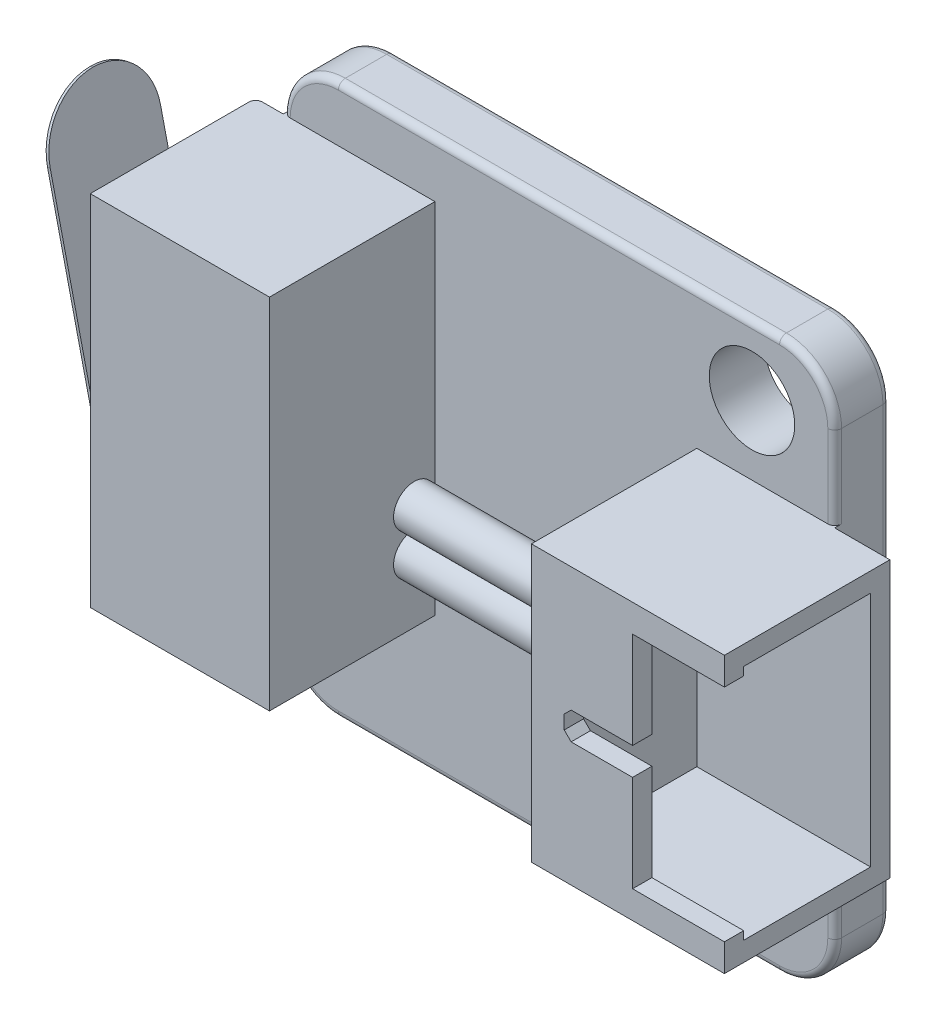
from build123d import *

# Parameters (mm, degrees)
CROQUIS1_W                          = 20
CROQUIS1_H                          = 20
SALIENTE_EXTRUIR1_DEPTH             = 2
CROQUIS2_W                          = 7
CROQUIS2_H                          = 10
SALIENTE_EXTRUIR2_DEPTH             = 6
CROQUIS3_W                          = 6.5
CROQUIS3_H                          = 13
SALIENTE_EXTRUIR3_DEPTH             = 6
SALIENTE_EXTRUIR4_DEPTH             = 4
CROQUIS6_W                          = 3
CROQUIS6_H                          = 12.5
SALIENTE_EXTRUIR6_DEPTH             = 2
CROQUIS7_W                          = 2
CROQUIS7_H                          = 7
SALIENTE_EXTRUIR7_DEPTH             = 2
CROQUIS8_W                          = 4.6
CROQUIS8_H                          = 8.6
CORTAR_EXTRUIR1_DEPTH               = 6.3
NGULO_DE_SALIDA1_ANGLE              = -77.005383208
NGULO_DE_SALIDA2_ANGLE              = 77.005383208
DI_METRO_DE_TALADRO_3_1_3_1_1_D     = 3.1
DI_METRO_DE_TALADRO_3_1_3_1_1_DEPTH = 4
REDONDEO2_R                         = 2
REDONDEO3_R                         = 2
REDONDEO4_R                         = 0.25
CORTAR_EXTRUIR2_DEPTH               = 1
CHAFL_N1_SIZE                       = 0.25
CROQUIS19_R                         = 0.75
SALIENTE_EXTRUIR9_DEPTH             = 10
SALIENTE_EXTRUIR9_2_DEPTH           = 10


# Some blends are built 0.0001 mm under size
with BuildPart() as part:
    # Croquis1 → Saliente-Extruir1 (new body)
    with BuildSketch(Plane.XY.offset(2)):
        Rectangle(CROQUIS1_W, CROQUIS1_H)
    extrude(amount=-SALIENTE_EXTRUIR1_DEPTH)

    # Croquis2 → Saliente-Extruir2 (add)
    with BuildSketch(Plane.XY.offset(2)):
        with Locations((8.5, 0)):
            Rectangle(CROQUIS2_W, CROQUIS2_H)
    extrude(amount=SALIENTE_EXTRUIR2_DEPTH)

    # Croquis3 → Saliente-Extruir3 (add)
    with BuildSketch(Plane.XY.offset(2)):
        with Locations((-7.75, 1.5)):
            Rectangle(CROQUIS3_W, CROQUIS3_H)
    extrude(amount=SALIENTE_EXTRUIR3_DEPTH)

    # Croquis4 → Saliente-Extruir4 (add)
    with BuildSketch(Plane.XY.offset(7)):
        Polygon((-68.40620408, -3.555277865), (-70.333333333, -4), (-11, -4), (-11, -3.555277865), align=None)
    extrude(amount=-SALIENTE_EXTRUIR4_DEPTH)

    # Croquis6 → Saliente-Extruir6 (add)
    with BuildSketch(Plane(origin=(0, 0, 0), x_dir=(-1, 0, 0), z_dir=(0, 0, -1))):
        with Locations((2.5, 1.25)):
            Rectangle(CROQUIS6_W, CROQUIS6_H)
    extrude(amount=SALIENTE_EXTRUIR6_DEPTH)

    # Croquis7 → Saliente-Extruir7 (add)
    with BuildSketch(Plane(origin=(0, 0, 0), x_dir=(-1, 0, 0), z_dir=(0, 0, -1))):
        with Locations((-5, 0)):
            Rectangle(CROQUIS7_W, CROQUIS7_H)
    extrude(amount=SALIENTE_EXTRUIR7_DEPTH)

    # Croquis8 → Cortar-Extruir1 (cut)
    with BuildSketch(Plane(origin=(12, 0, 0), x_dir=(0, 0, -1), z_dir=(1, 0, 0))):
        with Locations((-5, 0)):
            Rectangle(CROQUIS8_W, CROQUIS8_H)
    extrude(amount=-CORTAR_EXTRUIR1_DEPTH, mode=Mode.SUBTRACT)

    # Ángulo de salida1
    ngulo_de_salida1_faces = [part.faces().sort_by_distance(p)[0] for p in [
        (-39.70310204, -3.555277865, 5),
    ]]
    draft(ngulo_de_salida1_faces, Plane(origin=(-11, -5, 8), x_dir=(0, 0, -1), z_dir=(-1, 0, 0)), NGULO_DE_SALIDA1_ANGLE)

    # Ángulo de salida2
    ngulo_de_salida2_faces = [part.faces().sort_by_distance(p)[0] for p in [
        (-40.666666667, -4, 5),
    ]]
    draft(ngulo_de_salida2_faces, Plane(origin=(-11, -5, 8), x_dir=(0, 0, -1), z_dir=(-1, 0, 0)), NGULO_DE_SALIDA2_ANGLE)

    # Diámetro de taladro Ø3.1 (3.1)1
    with Locations(Plane.XY.offset(2)):
        with Locations((7, -7.5), (7, 7.5)):
            Hole(DI_METRO_DE_TALADRO_3_1_3_1_1_D / 2, depth=DI_METRO_DE_TALADRO_3_1_3_1_1_DEPTH)

    # Redondeo2
    redondeo2_edges = [part.edges().sort_by_distance(p)[0] for p in [
        (10, 10, 1),
        (10, -10, 1),
        (-10, -10, 1),
        (-10, 10, 1),
    ]]
    fillet(redondeo2_edges, radius=REDONDEO2_R)

    # Redondeo3
    redondeo3_edges = [part.edges().sort_by_distance(p)[0] for p in [
        (-13.95128044, 9.011242975, 7),
        (-13.95128044, 9.011242975, 3),
    ]]
    fillet(redondeo3_edges, radius=REDONDEO3_R - 0.0001)  # a hair under: the kernel refuses the full size

    # Redondeo4
    # the kernel refuses this fillet: 0.25 mm, written as the material it takes off along each edge
    with BuildSketch(Plane(origin=(8, 10, 2), x_dir=(0, -1, 0), z_dir=(-1, 0, 0)), Plane(origin=(8, 10, 0), x_dir=(0, 0, 1), z_dir=(-1, 0, 0)), Plane(origin=(-8, -10, 2), x_dir=(0, 1, 0), z_dir=(1, 0, 0)), Plane(origin=(-10, 8, 0), x_dir=(0, 0, 1), z_dir=(0, -1, 0)), Plane(origin=(10, -8, 0), x_dir=(0, 0, 1), z_dir=(0, 1, 0)), Plane(origin=(-8, -10, 0), x_dir=(0, 0, 1), z_dir=(1, 0, 0))) as redondeo4_piece_1:
        with BuildLine():
            CenterArc((REDONDEO4_R, -REDONDEO4_R), REDONDEO4_R, 90, 90)
            Line((0, -REDONDEO4_R), (0, 0))
            Line((0, 0), (REDONDEO4_R, 0))
        make_face()
    extrude(amount=16, mode=Mode.SUBTRACT)
    with BuildSketch(Plane(origin=(10, -8, 2), x_dir=(-1, 0, 0), z_dir=(0, 1, 0)), Plane(origin=(10, 5, 2), x_dir=(-1, 0, 0), z_dir=(0, 1, 0)), Plane(origin=(-10, -5, 2), x_dir=(1, 0, 0), z_dir=(0, -1, 0))) as redondeo4_piece_2:
        with BuildLine():
            CenterArc((REDONDEO4_R, -REDONDEO4_R), REDONDEO4_R, 90, 90)
            Line((0, -REDONDEO4_R), (0, 0))
            Line((0, 0), (REDONDEO4_R, 0))
        make_face()
    extrude(amount=3, mode=Mode.SUBTRACT)
    with BuildSketch(Plane(origin=(-8, -8, 2), x_dir=(-1, 0, 0), z_dir=(0, 1, 0))) as redondeo4_piece_3:
        with BuildLine():
            CenterArc((2 - REDONDEO4_R, -REDONDEO4_R), REDONDEO4_R, 0, 90)
            Line((2, -REDONDEO4_R), (2, 0))
            Line((2, 0), (2 - REDONDEO4_R, 0))
        make_face()
    revolve(axis=Axis((-8, -8, 2), (0, 0, 1)), revolution_arc=90, mode=Mode.SUBTRACT)
    with BuildSketch(Plane(origin=(8, -8, 2), x_dir=(0, -1, 0), z_dir=(-1, 0, 0))) as redondeo4_piece_4:
        with BuildLine():
            CenterArc((2 - REDONDEO4_R, -REDONDEO4_R), REDONDEO4_R, 0, 90)
            Line((2, -REDONDEO4_R), (2, 0))
            Line((2, 0), (2 - REDONDEO4_R, 0))
        make_face()
    revolve(axis=Axis((8, -8, 2), (0, 0, 1)), revolution_arc=90, mode=Mode.SUBTRACT)
    with BuildSketch(Plane(origin=(8, 8, 2), x_dir=(0, 1, 0), z_dir=(-1, 0, 0))) as redondeo4_piece_5:
        with BuildLine():
            CenterArc((2 - REDONDEO4_R, REDONDEO4_R), REDONDEO4_R, 270, 90)
            Line((2, REDONDEO4_R), (2, 0))
            Line((2, 0), (2 - REDONDEO4_R, 0))
        make_face()
    revolve(axis=Axis((8, 8, 2), (0, 0, -1)), revolution_arc=90, mode=Mode.SUBTRACT)
    with BuildSketch(Plane(origin=(-8, 8, 2), x_dir=(-1, 0, 0), z_dir=(0, -1, 0))) as redondeo4_piece_6:
        with BuildLine():
            CenterArc((2 - REDONDEO4_R, REDONDEO4_R), REDONDEO4_R, 270, 90)
            Line((2, REDONDEO4_R), (2, 0))
            Line((2, 0), (2 - REDONDEO4_R, 0))
        make_face()
    revolve(axis=Axis((-8, 8, 2), (0, 0, -1)), revolution_arc=90, mode=Mode.SUBTRACT)
    with BuildSketch(Plane(origin=(-8, -8, 0), x_dir=(-1, 0, 0), z_dir=(0, 1, 0))) as redondeo4_piece_7:
        with BuildLine():
            CenterArc((2 - REDONDEO4_R, REDONDEO4_R), REDONDEO4_R, 270, 90)
            Line((2 - REDONDEO4_R, 0), (2, 0))
            Line((2, 0), (2, REDONDEO4_R))
        make_face()
    revolve(axis=Axis((-8, -8, 0), (0, 0, 1)), revolution_arc=90, mode=Mode.SUBTRACT)
    with BuildSketch(Plane(origin=(8, -8, 0), x_dir=(0, -1, 0), z_dir=(-1, 0, 0))) as redondeo4_piece_8:
        with BuildLine():
            CenterArc((2 - REDONDEO4_R, REDONDEO4_R), REDONDEO4_R, 270, 90)
            Line((2 - REDONDEO4_R, 0), (2, 0))
            Line((2, 0), (2, REDONDEO4_R))
        make_face()
    revolve(axis=Axis((8, -8, 0), (0, 0, 1)), revolution_arc=90, mode=Mode.SUBTRACT)
    with BuildSketch(Plane(origin=(8, 8, 0), x_dir=(0, 1, 0), z_dir=(-1, 0, 0))) as redondeo4_piece_9:
        with BuildLine():
            CenterArc((2 - REDONDEO4_R, -REDONDEO4_R), REDONDEO4_R, 0, 90)
            Line((2 - REDONDEO4_R, 0), (2, 0))
            Line((2, 0), (2, -REDONDEO4_R))
        make_face()
    revolve(axis=Axis((8, 8, 0), (0, 0, -1)), revolution_arc=90, mode=Mode.SUBTRACT)
    with BuildSketch(Plane(origin=(-8, 8, 0), x_dir=(-1, 0, 0), z_dir=(0, -1, 0))) as redondeo4_piece_10:
        with BuildLine():
            CenterArc((2 - REDONDEO4_R, -REDONDEO4_R), REDONDEO4_R, 0, 90)
            Line((2 - REDONDEO4_R, 0), (2, 0))
            Line((2, 0), (2, -REDONDEO4_R))
        make_face()
    revolve(axis=Axis((-8, 8, 0), (0, 0, -1)), revolution_arc=90, mode=Mode.SUBTRACT)
    with BuildSketch(Plane(origin=(-11, -5.625, 2), x_dir=(0, 0, 1), z_dir=(0, 1, 0))) as redondeo4_piece_11:
        with BuildLine():
            CenterArc((REDONDEO4_R, REDONDEO4_R), REDONDEO4_R, 180, 90)
            Line((0, REDONDEO4_R), (0, 0))
            Line((0, 0), (REDONDEO4_R, 0))
        make_face()
    extrude(amount=14.25, mode=Mode.SUBTRACT)

    # Croquis16 → Cortar-Extruir2 (cut)
    with BuildSketch(Plane.XY.offset(8)):
        Polygon((12, -4), (8.669246852, -4), (8.669246852, -0.5), (6.190591253, -0.5), (6.190591253, 0.5), (8.669246852, 0.5), (8.669246852, 4), (12, 4), align=None)
    extrude(amount=-CORTAR_EXTRUIR2_DEPTH, mode=Mode.SUBTRACT)

    # Chaflán1
    chafl_n1_edges = [part.edges().sort_by_distance(p)[0] for p in [
        (6.190591253, -0.5, 7.65),
        (6.190591253, 0.5, 7.65),
    ]]
    chamfer(chafl_n1_edges, length=CHAFL_N1_SIZE)


with BuildPart() as body_2:
    # Croquis19 → Saliente-Extruir9 (new body)
    with BuildSketch(Plane(origin=(-4.5, 0, 0), x_dir=(0, 0, -1), z_dir=(1, 0, 0))):
        with Locations(Location((-2.75, -1.166325022, 0), (0, 0, 270))):
            Circle(CROQUIS19_R)
    extrude(amount=SALIENTE_EXTRUIR9_DEPTH)


with BuildPart() as body_3:
    # Croquis19 → Saliente-Extruir9 2 (new body)
    with BuildSketch(Plane(origin=(-4.5, 0, 0), x_dir=(0, 0, -1), z_dir=(1, 0, 0))):
        with Locations(Location((-2.75, -2.666325022, 0), (0, 0, 270))):
            Circle(CROQUIS19_R)
    extrude(amount=SALIENTE_EXTRUIR9_2_DEPTH)


solid = Compound([part.part, body_2.part, body_3.part])
